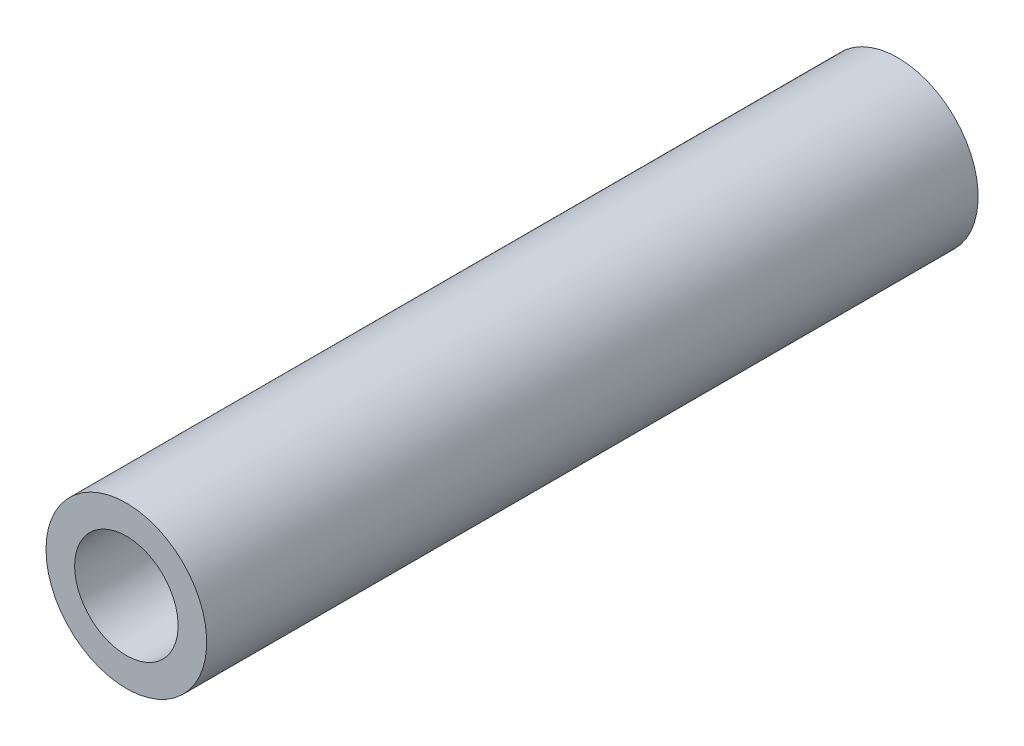
from build123d import *

# Parameters (mm, degrees)
SKETCH1_R           = 3.96875
SKETCH1_R_2         = 2.555
BOSS_EXTRUDE1_DEPTH = 38.1


with BuildPart() as part:
    # Sketch1 → Boss-Extrude1 (new body)
    with BuildSketch(Plane.XY):
        Circle(SKETCH1_R)
        Circle(SKETCH1_R_2, mode=Mode.SUBTRACT)
    extrude(amount=BOSS_EXTRUDE1_DEPTH)


solid = part.part
